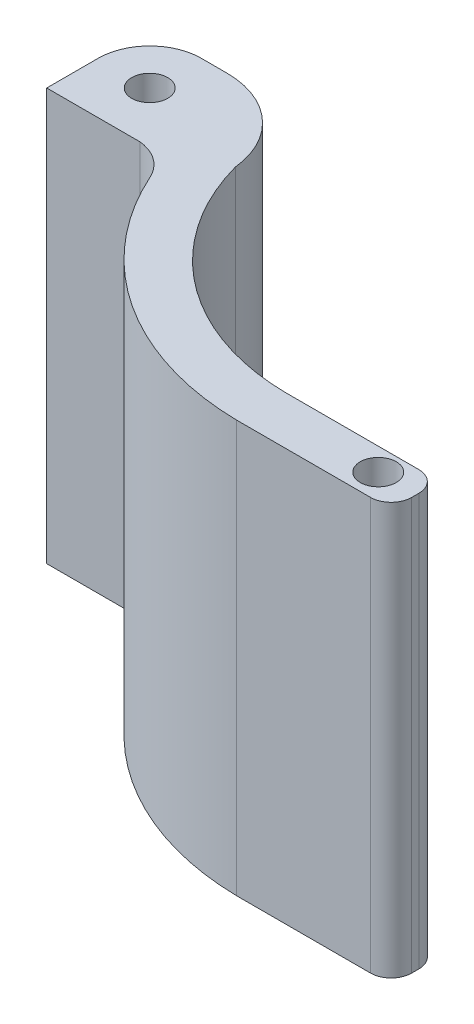
from build123d import *

# Parameters (mm, degrees)
SKETCH1_R           = 1.75
BOSS_EXTRUDE1_DEPTH = 40


with BuildPart() as part:
    # Sketch1 → Boss-Extrude1 (new body)
    with BuildSketch(Plane(origin=(0, 0, 0), x_dir=(1, 0, 0), z_dir=(0, 1, 0))):
        with BuildLine():
            Line((-96.891795497, 37.851994598), (-94.391795497, 37.851994598))
            ThreePointArc((-94.391795497, 37.851994598), (-88.795751162, 35.699613108), (-86.084398265, 30.351994598))
            ThreePointArc((-86.084398265, 30.351994598), (-78.166835514, 18.537721972), (-64.746042918, 13.831644657))
            Line((-64.746042918, 13.831644657), (-51.744759729, 13.831644657))
            ThreePointArc((-51.744759729, 13.831644657), (-50.330546167, 13.24585822), (-49.744759729, 11.831644657))
            Line((-49.744759729, 11.831644657), (-49.744759729, 11.145363221))
            ThreePointArc((-49.744759729, 11.145363221), (-50.330546167, 9.731149659), (-51.744759729, 9.145363221))
            Line((-51.744759729, 9.145363221), (-64.744759729, 9.145363221))
            ThreePointArc((-64.744759729, 9.145363221), (-79.409940936, 13.671363127), (-89.365595782, 25.351994598))
            ThreePointArc((-89.365595782, 25.351994598), (-90.770555072, 27.069790868), (-92.847305409, 27.851994598))
            Line((-92.847305409, 27.851994598), (-101.891795497, 27.851994598))
            Line((-101.891795497, 27.851994598), (-101.891795497, 32.851994598))
            ThreePointArc((-101.891795497, 32.851994598), (-100.427329403, 36.387528504), (-96.891795497, 37.851994598))
        make_face()
        with Locations((-96.891795497, 32.851994598)):
            Circle(SKETCH1_R, mode=Mode.SUBTRACT)
        with Locations((-53.494759729, 11.645363221)):
            Circle(SKETCH1_R, mode=Mode.SUBTRACT)
    extrude(amount=BOSS_EXTRUDE1_DEPTH)


solid = part.part
